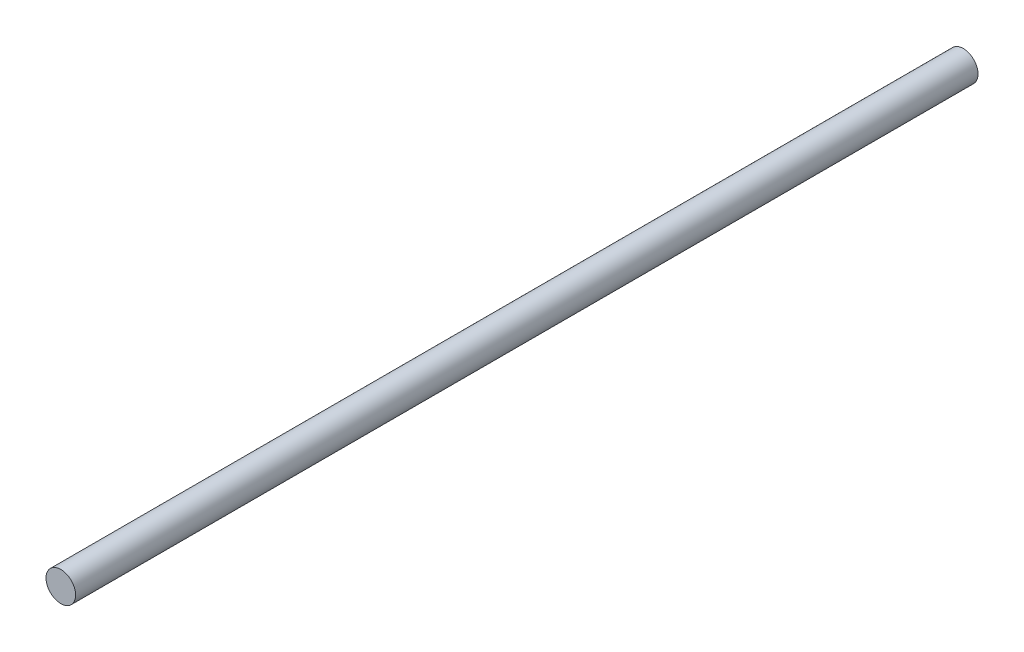
from build123d import *

# Parameters (mm, degrees)
SKETCH1_R           = 2.5
BOSS_EXTRUDE1_DEPTH = 152.4


with BuildPart() as part:
    # Sketch1 → Boss-Extrude1 (new body)
    with BuildSketch(Plane.XY):
        Circle(SKETCH1_R)
    extrude(amount=BOSS_EXTRUDE1_DEPTH)


solid = part.part
